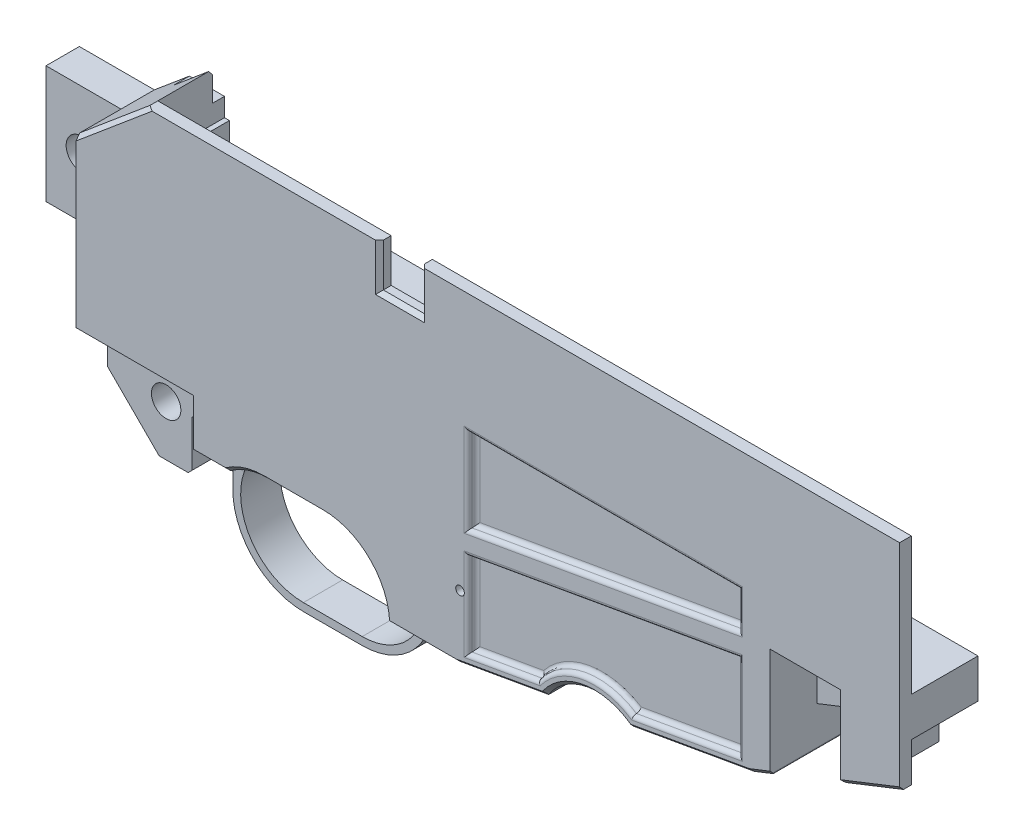
from build123d import *

# Parameters (mm, degrees)
EXTRUDE_1_DEPTH      = 20
SKETCH_3_W           = 72.75
SKETCH_3_H           = 52
CUT_EXTRUDE_1_DEPTH  = 8.25
SKETCH_4_W           = 173.123696111
SKETCH_4_H           = 12.22
CUT_EXTRUDE_2_DEPTH  = 17
CUT_EXTRUDE_3_DEPTH  = 14
CUT_EXTRUDE_4_DEPTH  = 5
CUT_EXTRUDE_5_DEPTH  = 8
CUT_EXTRUDE_7_REACH  = 254.082
SKETCH_9_W           = 18
SKETCH_9_H           = 10
SKETCH_9_W_2         = 7.5
SKETCH_9_4_W         = 7.5
SKETCH_9_4_H         = 10
SKETCH_9_4_W_2       = 18
CUT_EXTRUDE_9_DEPTH  = 30.86
FILLET_START         = 50
FILLET_2_DEPTH       = 1.9999999
FILLET_START_2       = 51.9999999
FILLET_2_2_DEPTH     = 6.480525325
FILLET_START_3       = 10
FILLET_2_3_DEPTH     = 10.0000001
SKETCH_8_W           = 8.39
SKETCH_8_H           = 12.86
CUT_EXTRUDE_11_DEPTH = 6
CHAMFER_2_SIZE       = 1
FILLET_3_SIZE        = 6
FILLET_3_SIZE_2      = 8
SKETCH_11_W          = 118.13
SKETCH_11_H          = 35
CUT_EXTRUDE_15_DEPTH = 17
SKETCH_12_W          = 10
SKETCH_12_H          = 25
CUT_EXTRUDE_16_DEPTH = 17
CUT_EXTRUDE_18_REACH = 248.442
CUT_EXTRUDE_21_DEPTH = 6.25
FILLET_5_R           = 2
CUT_EXTRUDE_23_REACH = 247.923
SKETCH_22_R          = 3.75
CHAMFER_3_SIZE       = 1
SKETCH_25_W          = 20
SKETCH_25_H          = 30
CUT_EXTRUDE_26_DEPTH = 11.5
CUT_EXTRUDE_27_DEPTH = 2
FILLET_6_R           = 1
SKETCH_32_W          = 3
SKETCH_32_H          = 7.5
CUT_EXTRUDE_28_DEPTH = 10
CHAMFER_5_SIZE       = 1
SKETCH_33_R          = 2
CUT_EXTRUDE_29_DEPTH = 246.408981914
CHAMFER_6_SIZE       = 1
EXTRUDE_2_DEPTH      = 2
CHAMFER_7_SIZE       = 0.5
SKETCH_35_R          = 4
CUT_EXTRUDE_30_DEPTH = 246.89863444
CHAMFER_8_SIZE       = 1
CUT_EXTRUDE_31_DEPTH = 8
SKETCH_37_R          = 2.5
CUT_EXTRUDE_32_DEPTH = 4
FILLET_7_R           = 0.5
CHAMFER_9_SIZE       = 2
SKETCH_38_W          = 18
SKETCH_38_H          = 36.075856996
CUT_EXTRUDE_33_DEPTH = 12
CUT_EXTRUDE_37_REACH = 247.923
FILLET_9_R           = 0.5
CUT_EXTRUDE_38_REACH = 247.923
SKETCH_43_R          = 4
FILLET_10_R          = 1
SKETCH_44_W          = 10.5
SKETCH_44_H          = 11
CUT_EXTRUDE_39_DEPTH = 3
EXTRUDE_3_DEPTH      = 7.75
SKETCH_46_W          = 6.5
SKETCH_46_H          = 48.22
CUT_EXTRUDE_40_DEPTH = 2
SKETCH_47_R          = 2.5
CUT_EXTRUDE_41_DEPTH = 3
SKETCH_48_R          = 1.1
CUT_EXTRUDE_42_DEPTH = 246.864700434
EXTRUDE_4_DEPTH      = 6.25
SKETCH_51_R          = 2
CUT_EXTRUDE_43_DEPTH = 4.5
CHAMFER_10_SIZE      = 1
CHAMFER_11_SIZE      = 1
CHAMFER_12_SIZE      = 1
CHAMFER_12_SIZE2     = 0.869286738


with BuildPart() as part:
    # 스케치2 → 보스-돌출1 (new body)
    with BuildSketch(Plane.XY):
        with BuildLine():
            Line((0, 0), (20, 0))
            Line((20, 0), (37.876303889, 15))
            Line((37.876303889, 15), (230, 15))
            Line((230, 15), (230, -54.995476447))
            Line((230, -54.995476447), (192, -54.995476447))
            Line((192, -54.995476447), (161.21786811, -60.423196823))
            ThreePointArc((161.21786811, -60.423196823), (149.551131055, -57.604318381), (139.552097544, -64.243456731))
            Line((139.552097544, -64.243456731), (117, -68.22))
            Line((117, -68.22), (101, -68.22))
            ThreePointArc((101, -68.22), (95.727922061, -80.947922061), (83, -86.22))
            Line((83, -86.22), (68, -86.22))
            ThreePointArc((68, -86.22), (55.272077939, -80.947922061), (50, -68.22))
            Line((50, -68.22), (33.22, -68.22))
            Line((33.22, -68.22), (20, -55))
            Line((20, -55), (20, -30))
            Line((20, -30), (0, -30))
            Line((0, -30), (0, 0))
        make_face()
        with BuildLine():
            Line((68, -52.22), (83, -52.22))
            ThreePointArc((83, -52.22), (99, -68.22), (83, -84.22))
            Line((83, -84.22), (68, -84.22))
            ThreePointArc((68, -84.22), (52, -68.22), (68, -52.22))
        make_face(mode=Mode.SUBTRACT)
    extrude(amount=EXTRUDE_1_DEPTH)

    # 스케치3 → 컷-돌출1 (cut)
    with BuildSketch(Plane(origin=(0, 0, 0), x_dir=(-1, 0, 0), z_dir=(0, 0, -1))):
        with Locations((-75.5, -23.22)):
            Rectangle(SKETCH_3_W, SKETCH_3_H)
    extrude(amount=-CUT_EXTRUDE_1_DEPTH, mode=Mode.SUBTRACT)

    # 스케치4 → 컷-돌출2 (cut)
    with BuildSketch(Plane(origin=(0, 0, 0), x_dir=(-1, 0, 0), z_dir=(0, 0, -1))):
        with Locations((-124.438151944, 8.89)):
            Rectangle(SKETCH_4_W, SKETCH_4_H)
    extrude(amount=-CUT_EXTRUDE_2_DEPTH, mode=Mode.SUBTRACT)

    # 스케치5 → 컷-돌출3 (cut)
    with BuildSketch(Plane(origin=(0, 0, 0), x_dir=(-1, 0, 0), z_dir=(0, 0, -1))):
        with BuildLine():
            Line((-117, 2.78), (-192, 2.78))
            Line((-192, 2.78), (-192, -54.995476447))
            Line((-192, -54.995476447), (-161.21786811, -60.423196823))
            ThreePointArc((-161.21786811, -60.423196823), (-149.551131055, -57.604318381), (-139.552097544, -64.243456731))
            Line((-139.552097544, -64.243456731), (-117, -68.22))
            Line((-117, -68.22), (-117, 2.78))
        make_face()
    extrude(amount=-CUT_EXTRUDE_3_DEPTH, mode=Mode.SUBTRACT)

    # 스케치6 → 컷-돌출4 (cut)
    with BuildSketch(Plane(origin=(0, 0, 0), x_dir=(-1, 0, 0), z_dir=(0, 0, -1))):
        with BuildLine():
            Line((-88, -49.22), (-63, -49.22))
            Line((-63, -49.22), (-63, -53.021315846))
            ThreePointArc((-63, -53.021315846), (-65.468098191, -52.421599029), (-68, -52.22))
            Line((-68, -52.22), (-83, -52.22))
            ThreePointArc((-83, -52.22), (-85.531901809, -52.421599029), (-88, -53.021315846))
            Line((-88, -53.021315846), (-88, -49.22))
        make_face()
    extrude(amount=-CUT_EXTRUDE_4_DEPTH, mode=Mode.SUBTRACT)

    # 스케치7 → 컷-돌출5 (cut)
    with BuildSketch(Plane.XY.offset(20)):
        Polygon((20, -42.5), (50, -42.5), (50, -68.22), (33.22, -68.22), (20, -55), align=None)
    extrude(amount=-CUT_EXTRUDE_5_DEPTH, mode=Mode.SUBTRACT)

    # 컷-돌출7: up to this face of the body (flat: up to its plane)
    cut_extrude_7_end = Plane(part.part.faces().sort_by_distance((109, -68.22, 10))[0])
    # 스케치9 → 컷-돌출7 (cut, up to the picked face)
    with BuildSketch(Plane.XZ.offset(86.22), mode=Mode.PRIVATE) as cut_extrude_7_sk1:
        with Locations((92, 15)):
            Rectangle(SKETCH_9_W, SKETCH_9_H)
    cut_extrude_7_tool1 = split(extrude(cut_extrude_7_sk1.sketch, amount=-CUT_EXTRUDE_7_REACH, mode=Mode.PRIVATE), bisect_by=cut_extrude_7_end, keep=Keep.BOTH, mode=Mode.PRIVATE)
    # 스케치9 → 컷-돌출7 (cut, up to the picked face)
    with BuildSketch(Plane.XZ.offset(86.22), mode=Mode.PRIVATE) as cut_extrude_7_sk2:
        with Locations((79.25, 15)):
            Rectangle(SKETCH_9_W_2, SKETCH_9_H)
    cut_extrude_7_tool2 = split(extrude(cut_extrude_7_sk2.sketch, amount=-CUT_EXTRUDE_7_REACH, mode=Mode.PRIVATE), bisect_by=cut_extrude_7_end, keep=Keep.BOTH, mode=Mode.PRIVATE)
    add(cut_extrude_7_tool1.solids().sort_by(Axis((92, -86.22, 15), (0, 1, 0)))[0], mode=Mode.SUBTRACT)
    add(cut_extrude_7_tool2.solids().sort_by(Axis((79.25, -86.22, 15), (0, 1, 0)))[0], mode=Mode.SUBTRACT)

    # 스케치9<4> → 컷-돌출9 (cut)
    with BuildSketch(Plane.XZ.offset(86.22)):
        with Locations((71.75, 15)):
            Rectangle(SKETCH_9_4_W, SKETCH_9_4_H)
        with Locations((59, 15)):
            Rectangle(SKETCH_9_4_W_2, SKETCH_9_4_H)
    extrude(amount=-CUT_EXTRUDE_9_DEPTH, mode=Mode.SUBTRACT)

    # 필렛2: read off the stored shape, not the designer's step
    # 필렛2 outline → 필렛2 (add)
    with BuildSketch(Plane.YZ.offset(FILLET_START)):
        with BuildLine():
            Line((-55.36, 10), (-55.36, 19))
            add(Edge.make_bspline(
                [(-55.36, 19), (-55.36, 10), (-62.86, 10)],
                knots=[0, 0, 0, 1, 1, 1], degree=2, weights=[1, 0.707106781, 1]))
            Line((-62.86, 10), (-55.36, 10))
        make_face()
    extrude(amount=FILLET_2_DEPTH)

    # Fillet 2 2 outline → Fillet 2 2 (add)
    with BuildSketch(Plane.YZ.offset(FILLET_START_2)):
        with BuildLine():
            Line((-55.36, 10), (-55.36, 19))
            add(Edge.make_bspline(
                [(-55.36, 19), (-55.36, 10), (-62.86, 10)],
                knots=[0, 0, 0, 1, 1, 1], degree=2, weights=[1, 0.707106781, 1]))
            Line((-62.86, 10), (-55.36, 10))
        make_face()
    extrude(amount=FILLET_2_2_DEPTH)

    # Fillet 2 3 outline → Fillet 2 3 (cut)
    with BuildSketch(Plane.XY.offset(FILLET_START_3)):
        with BuildLine():
            ThreePointArc((58.480525225, -55.36), (54.796795727, -59.182555841), (52.566542837, -64))
            Line((52.566542837, -64), (58.480525225, -64))
            Line((58.480525225, -64), (58.480525225, -55.36))
        make_face()
    extrude(amount=FILLET_2_3_DEPTH, mode=Mode.SUBTRACT)

    # 스케치8 → 컷-돌출11 (cut)
    with BuildSketch(Plane.XY.offset(12)):
        with Locations((45.805, -61.79)):
            Rectangle(SKETCH_8_W, SKETCH_8_H)
    extrude(amount=-CUT_EXTRUDE_11_DEPTH, mode=Mode.SUBTRACT)

    # 모따기2
    chamfer_2_edges = [part.edges().sort_by_distance(p)[0] for p in [
        (41.61, -68.22, 9),
    ]]
    chamfer(chamfer_2_edges, length=CHAMFER_2_SIZE)

    # 필렛3
    # a fillet whose section is not a circle: 8, 6 mm, written as the material it adds along each edge
    with BuildSketch(Plane(origin=(121, -68.22, 10), x_dir=(0, 0, 1), z_dir=(-1, 0, 0))) as fillet_3_piece_1_section:
        with BuildLine():
            Bezier((FILLET_3_SIZE, 0), (0, 0), (0, -FILLET_3_SIZE_2), weights=[1, 0.707106781, 1])
            Line((0, -FILLET_3_SIZE_2), (0, 0))
            Line((0, 0), (FILLET_3_SIZE, 0))
        make_face()
    fillet_3_piece_1 = extrude(amount=42, mode=Mode.PRIVATE)
    fillet_3_piece_1 = fillet_3_piece_1 - Plane(origin=(83, -68.22, 10), x_dir=(0, 1, 0), z_dir=(0, 0, -1)) * Cylinder(16, 117, mode=Mode.PRIVATE)
    fillet_3_piece_1 = fillet_3_piece_1 & Plane(origin=(83, -68.22, 10), x_dir=(1, 0, 0), z_dir=(0, 0, -1)) * Cylinder(18, 117, mode=Mode.PRIVATE)
    add(fillet_3_piece_1)

    # 스케치11 → 컷-돌출15 (cut)
    with BuildSketch(Plane(origin=(0, 0, 0), x_dir=(-1, 0, 0), z_dir=(0, 0, -1))):
        with Locations((-170.935, -2.5)):
            Rectangle(SKETCH_11_W, SKETCH_11_H)
    extrude(amount=-CUT_EXTRUDE_15_DEPTH, mode=Mode.SUBTRACT)

    # 스케치12 → 컷-돌출16 (cut)
    with BuildSketch(Plane(origin=(0, 0, 0), x_dir=(-1, 0, 0), z_dir=(0, 0, -1))):
        with Locations((-225, -42.495476447)):
            Rectangle(SKETCH_12_W, SKETCH_12_H)
    extrude(amount=-CUT_EXTRUDE_16_DEPTH, mode=Mode.SUBTRACT)

    # 스케치16 → 컷-돌출18 (cut, up to next)
    with BuildSketch(Plane.XY.offset(20), mode=Mode.PRIVATE) as cut_extrude_18_sk1:
        Polygon((192, -54.995476447), (230, -39.995476447), (230, -54.995476447), align=None)
    cut_extrude_18_tool1 = extrude(cut_extrude_18_sk1.sketch, amount=-CUT_EXTRUDE_18_REACH, mode=Mode.PRIVATE) & part.part
    add(cut_extrude_18_tool1.solids().sort_by_distance((217.333333, -49.995476, 20))[0], mode=Mode.SUBTRACT)

    # 스케치20 → 컷-돌출21 (cut)
    with BuildSketch(Plane(origin=(0, 0, 0), x_dir=(-1, 0, 0), z_dir=(0, 0, -1))):
        Polygon((-113, -68.22), (-103, -68.22), (-103, -50.22), (-111.875, -50.22), (-111.875, -36.22), (-117, -36.22), (-117, -64.22), (-117, -68.22), align=None)
    extrude(amount=-CUT_EXTRUDE_21_DEPTH, mode=Mode.SUBTRACT)

    # 필렛5
    fillet_5_edges = [part.edges().sort_by_distance(p)[0] for p in [
        (103, -50.22, 3.125),
    ]]
    fillet(fillet_5_edges, radius=FILLET_5_R)

    # 스케치22 → 컷-돌출23 (cut, up to next)
    with BuildSketch(Plane.XY.offset(12), mode=Mode.PRIVATE) as cut_extrude_23_sk1:
        with Locations((35, -55.36)):
            Circle(SKETCH_22_R)
    cut_extrude_23_tool1 = extrude(cut_extrude_23_sk1.sketch, amount=-CUT_EXTRUDE_23_REACH, mode=Mode.PRIVATE) & part.part
    add(cut_extrude_23_tool1.solids().sort_by_distance((35, -55.36, 12))[0], mode=Mode.SUBTRACT)

    # 모따기3
    chamfer_3_edges = [part.edges().sort_by_distance(p)[0] for p in [
        (111.875, -50.22, 3.125),
    ]]
    chamfer(chamfer_3_edges, length=CHAMFER_3_SIZE - 0.0001)  # a hair under: the kernel refuses the full size

    # 스케치25 → 컷-돌출26 (cut)
    with BuildSketch(Plane.XY.offset(20)):
        with Locations((10, -15)):
            Rectangle(SKETCH_25_W, SKETCH_25_H)
    extrude(amount=-CUT_EXTRUDE_26_DEPTH, mode=Mode.SUBTRACT)

    # 스케치30 → 컷-돌출27 (cut)
    with BuildSketch(Plane.XY.offset(20)):
        with BuildLine():
            Line((120, -43.147704093), (120, -64.644739222))
            Line((120, -64.644739222), (137.810226103, -61.504315828))
            ThreePointArc((137.810226103, -61.504315828), (149.030186522, -54.649895122), (161.917850486, -57.253491208))
            Line((161.917850486, -57.253491208), (189, -52.478177553))
            Line((189, -52.478177553), (189, -30.981142425))
            Line((189, -30.981142425), (120, -43.147704093))
        make_face()
        Polygon((120, -15.741822447), (120, -37.238857575), (189, -25.072295907), (189, -15.741822447), align=None)
    extrude(amount=-CUT_EXTRUDE_27_DEPTH, mode=Mode.SUBTRACT)

    # 필렛6
    fillet_6_edges = [part.edges().sort_by_distance(p)[0] for p in [
        (128.905113051, -63.074527525, 20),
        (128.905113051, -63.074527525, 18),
        (149.030186522, -54.649895122, 20),
        (149.030186522, -54.649895122, 18),
        (175.458925243, -54.865834381, 18),
        (175.458925243, -54.865834381, 20),
        (189, -41.729659989, 20),
        (120, -53.896221658, 20),
        (120, -53.896221658, 18),
        (189, -41.729659989, 18),
        (154.5, -37.064423259, 20),
        (154.5, -37.064423259, 18),
        (189, -20.407059177, 20),
        (189, -20.407059177, 18),
        (154.5, -31.155576741, 20),
        (154.5, -31.155576741, 18),
        (120, -26.490340011, 18),
        (120, -26.490340011, 20),
        (154.5, -15.741822447, 18),
        (154.5, -15.741822447, 20),
    ]]
    fillet(fillet_6_edges, radius=FILLET_6_R - 0.0001)  # a hair under: the kernel refuses the full size

    # 스케치32 → 컷-돌출28 (cut)
    with BuildSketch(Plane(origin=(37.876303889, 0, 0), x_dir=(0, 0, -1), z_dir=(1, 0, 0))):
        with Locations((-1.5, 11.25)):
            Rectangle(SKETCH_32_W, SKETCH_32_H)
    extrude(amount=-CUT_EXTRUDE_28_DEPTH, mode=Mode.SUBTRACT)

    # 모따기5
    chamfer_5_edges = [part.edges().sort_by_distance(p)[0] for p in [
        (33.407227917, 11.25, 3),
    ]]
    chamfer(chamfer_5_edges, length=CHAMFER_5_SIZE)

    # 스케치33 → 컷-돌출29 (cut, through all)
    with BuildSketch(Plane.XZ.offset(68.22)):
        with Locations((43.375, 0)):
            Circle(SKETCH_33_R)
    extrude(amount=-CUT_EXTRUDE_29_DEPTH, mode=Mode.SUBTRACT)

    # 모따기6
    chamfer_6_edges = [part.edges().sort_by_distance(p)[0] for p in [
        (43.375, -68.22, 2),
    ]]
    chamfer(chamfer_6_edges, length=CHAMFER_6_SIZE)

    # 보스-돌출2: read off the stored shape, not the designer's step
    # 보스-돌출2 outline → 보스-돌출2 (add)
    with BuildSketch(Plane(origin=(0, -49.22, 0), x_dir=(1, 0, 0), z_dir=(0, 1, 0))):
        with BuildLine():
            Line((101.6, 0), (97.65, 0))
            ThreePointArc((97.65, 0), (99.625, -1.975), (101.6, 0))
        make_face()
    extrude(amount=EXTRUDE_2_DEPTH)

    # 모따기7
    chamfer_7_edges = [part.edges().sort_by_distance(p)[0] for p in [
        (99.625, -47.22, 1.975),
    ]]
    chamfer(chamfer_7_edges, length=CHAMFER_7_SIZE)

    # 스케치35 → 컷-돌출30 (cut, through all)
    with BuildSketch(Plane.XY.offset(8.5)):
        with Locations((10, -15)):
            Circle(SKETCH_35_R)
    extrude(amount=-CUT_EXTRUDE_30_DEPTH, mode=Mode.SUBTRACT)

    # 모따기8
    chamfer_8_edges = [part.edges().sort_by_distance(p)[0] for p in [
        (54.240262612, -55.36, 20),
        (28.938151944, 7.5, 20),
        (62.988014366, -53.025264069, 20),
        (94.313708499, -56.906291501, 20),
        (75.5, -52.22, 20),
        (211, -47.495476447, 20),
        (176.608934055, -57.709336635, 20),
        (149.551131055, -57.604318381, 20),
        (128.276048772, -66.231728366, 20),
        (108, -68.22, 20),
    ]]
    chamfer(chamfer_8_edges, length=CHAMFER_8_SIZE - 0.0001)  # a hair under: the kernel refuses the full size

    # 스케치36 → 컷-돌출31 (cut)
    with BuildSketch(Plane(origin=(0, 0, 8.25), x_dir=(-1, 0, 0), z_dir=(0, 0, -1))):
        Polygon((-93.125, -3.22), (-93.125, -39.22), (-57.125, -3.22), align=None)
        Polygon((-86.125, -43.22), (-51.125, -43.22), (-51.125, -8.22), align=None)
    extrude(amount=-CUT_EXTRUDE_31_DEPTH, mode=Mode.SUBTRACT)

    # 스케치37 → 컷-돌출32 (cut)
    with BuildSketch(Plane(origin=(0, 0, 8.25), x_dir=(-1, 0, 0), z_dir=(0, 0, -1))):
        with Locations((-106.817, -8.72)):
            Circle(SKETCH_37_R)
        with Locations((-44.625, -24.22)):
            Circle(SKETCH_37_R)
        with Locations((-99.637, -35.72)):
            Circle(SKETCH_37_R)
    extrude(amount=-CUT_EXTRUDE_32_DEPTH, mode=Mode.SUBTRACT)

    # 필렛7
    fillet_7_edges = [part.edges().sort_by_distance(p)[0] for p in [
        (109.317, -8.72, 8.25),
        (47.125, -24.22, 8.25),
        (102.137, -35.72, 8.25),
    ]]
    fillet(fillet_7_edges, radius=FILLET_7_R)

    # 모따기9
    # the kernel refuses this chamfer: 3.488497995, 2 mm, written as the material it takes off along each edge
    with BuildSketch(Plane(origin=(63, -53.021315846, -16.015121009), x_dir=(0, 1, 0), z_dir=(0, 0, 1))) as chamfer_9_piece_1:
        with BuildLine():
            Line((CHAMFER_9_SIZE, 0), (-3.088579607, 5.456833549))
            ThreePointArc((-3.088579607, 5.456833549), (-1.308607067, 2.94139525), (0, 0))
            Line((0, 0), (CHAMFER_9_SIZE, 0))
        make_face()
    extrude(amount=21.015121009, mode=Mode.SUBTRACT)

    # 스케치38 → 컷-돌출33 (cut)
    with BuildSketch(Plane.XY.offset(20)):
        with Locations((206, -43.037928498)):
            Rectangle(SKETCH_38_W, SKETCH_38_H)
    extrude(amount=-CUT_EXTRUDE_33_DEPTH, mode=Mode.SUBTRACT)

    # 스케치41 → 컷-돌출37 (cut, up to next)
    with BuildSketch(Plane.XY.offset(8), mode=Mode.PRIVATE) as cut_extrude_37_sk1:
        Polygon((215, -35.916529078), (197, -43.021792236), (197, -53.021792236), (215, -45.916529078), align=None)
    cut_extrude_37_tool1 = extrude(cut_extrude_37_sk1.sketch, amount=-CUT_EXTRUDE_37_REACH, mode=Mode.PRIVATE) & part.part
    add(cut_extrude_37_tool1.solids().sort_by_distance((206, -44.469161, 8))[0], mode=Mode.SUBTRACT)

    # 필렛9
    fillet_9_edges = [part.edges().sort_by_distance(p)[0] for p in [
        (197, -53.021792236, 9.50005),
        (215, -45.916529078, 9.50005),
    ]]
    fillet(fillet_9_edges, radius=FILLET_9_R)

    # 스케치43 → 컷-돌출38 (cut, up to next)
    with BuildSketch(Plane.XY.offset(8), mode=Mode.PRIVATE) as cut_extrude_38_sk1:
        with Locations((206, -31.469160657)):
            Circle(SKETCH_43_R)
    cut_extrude_38_tool1 = extrude(cut_extrude_38_sk1.sketch, amount=-CUT_EXTRUDE_38_REACH, mode=Mode.PRIVATE) & part.part
    add(cut_extrude_38_tool1.solids().sort_by_distance((206, -31.469161, 8))[0], mode=Mode.SUBTRACT)

    # 필렛10
    fillet_10_edges = [part.edges().sort_by_distance(p)[0] for p in [
        (202, -31.469160657, 8),
    ]]
    fillet(fillet_10_edges, radius=FILLET_10_R)

    # 스케치44 → 컷-돌출39 (cut)
    with BuildSketch(Plane.XY.offset(20)):
        with Locations((102.632027716, 9.5)):
            Rectangle(SKETCH_44_W, SKETCH_44_H)
    extrude(amount=-CUT_EXTRUDE_39_DEPTH, mode=Mode.SUBTRACT)

    # 스케치45 → 보스-돌출3 (add)
    with BuildSketch(Plane(origin=(0, 0, 14), x_dir=(-1, 0, 0), z_dir=(0, 0, -1))):
        Polygon((-117, -20), (-125, -20), (-125, -66.809384154), (-117, -68.22), align=None)
    extrude(amount=EXTRUDE_3_DEPTH)

    # 스케치46 → 컷-돌출40 (cut)
    with BuildSketch(Plane(origin=(125, 0, 0), x_dir=(0, 0, -1), z_dir=(1, 0, 0))):
        with Locations((-3.25, -44.11)):
            Rectangle(SKETCH_46_W, SKETCH_46_H)
    extrude(amount=-CUT_EXTRUDE_40_DEPTH, mode=Mode.SUBTRACT)

    # 스케치47 → 컷-돌출41 (cut)
    with BuildSketch(Plane(origin=(0, 0, 6.25), x_dir=(-1, 0, 0), z_dir=(0, 0, -1))):
        with Locations((-117.4375, -51.691019058)):
            Circle(SKETCH_47_R)
    extrude(amount=-CUT_EXTRUDE_41_DEPTH, mode=Mode.SUBTRACT)

    # 스케치48 → 컷-돌출42 (cut, through all)
    with BuildSketch(Plane(origin=(0, 0, 9.25), x_dir=(-1, 0, 0), z_dir=(0, 0, -1))):
        with Locations((-117.9375, -51.602855568)):
            Circle(SKETCH_48_R)
    extrude(amount=-CUT_EXTRUDE_42_DEPTH, mode=Mode.SUBTRACT)

    # 스케치50 → 보스-돌출4 (add)
    with BuildSketch(Plane(origin=(0, 0, 6.25), x_dir=(-1, 0, 0), z_dir=(0, 0, -1))):
        Polygon((-123, -67.162038116), (-117, -68.22), (-115.95, -68.22), (-116.447878901, -61.1), (-123, -56.362038116), align=None)
    extrude(amount=EXTRUDE_4_DEPTH)

    # 스케치51 → 컷-돌출43 (cut)
    with BuildSketch(Plane(origin=(120.132985759, -8.400516703, 0), x_dir=(0, 0, 1), z_dir=(-0.9975640502598241, 0.06975647374412902, 0))):
        with Locations((0, -55.328170064)):
            Circle(SKETCH_51_R)
    extrude(amount=-CUT_EXTRUDE_43_DEPTH, mode=Mode.SUBTRACT)

    # 모따기10
    chamfer_10_edges = [part.edges().sort_by_distance(p)[0] for p in [
        (102.632027716, 4, 20),
    ]]
    chamfer(chamfer_10_edges, length=CHAMFER_10_SIZE)

    # 모따기11
    chamfer_11_edges = [part.edges().sort_by_distance(p)[0] for p in [
        (107.882027716, 9, 20),
        (97.382027716, 9, 20),
    ]]
    chamfer(chamfer_11_edges, length=CHAMFER_11_SIZE)

    # 모따기12
    chamfer_12_edges = [part.edges().sort_by_distance(p)[0] for p in [
        (0, -30, 4.25),
        (0, 0, 4.25),
        (0, -15, 8.5),
    ]]
    chamfer_12_side = [part.faces().sort_by_distance(p)[0] for p in [
        (0, -15, 4.25),
    ]]
    chamfer(chamfer_12_edges, length=CHAMFER_12_SIZE, length2=CHAMFER_12_SIZE2, reference=chamfer_12_side[0])


solid = part.part
